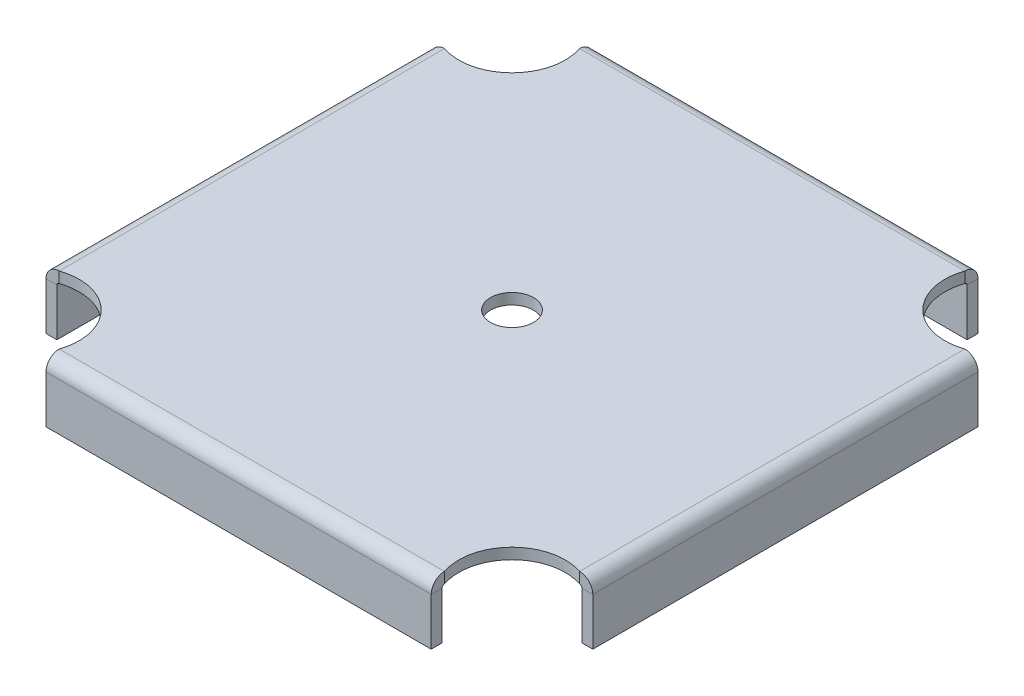
from build123d import *

# Parameters (mm, degrees)
SKETCH3_R                 = 6.7437
BASE_FLANGE1_DEPTH        = 3.4163
EDGE_FLANGE1_DEPTH        = 120.765617952
EDGE_FLANGE1_BEND_DEPTH   = 120.765617952
EDGE_FLANGE1_BEND_2_DEPTH = 120.765617952
EDGE_FLANGE1_BEND_3_DEPTH = 120.765617952


# Sheet-metal steps are written as plain solids
with BuildPart() as part:
    # Sketch3 → Base-Flange1 (new body)
    with BuildSketch(Plane(origin=(0, 0, 0), x_dir=(1, 0, 0), z_dir=(0, 1, 0))):
        with BuildLine():
            Line((-60.382808976, 81.5594), (60.382808976, 81.5594))
            ThreePointArc((60.382808976, 81.5594), (64.390963201, 64.390963201), (81.5594, 60.382808976))
            Line((81.5594, 60.382808976), (81.5594, -60.382808976))
            ThreePointArc((81.5594, -60.382808976), (64.390963201, -64.390963201), (60.382808976, -81.5594))
            Line((60.382808976, -81.5594), (-60.382808976, -81.5594))
            ThreePointArc((-60.382808976, -81.5594), (-64.390963201, -64.390963201), (-81.5594, -60.382808976))
            Line((-81.5594, -60.382808976), (-81.5594, 60.382808976))
            ThreePointArc((-81.5594, 60.382808976), (-64.390963201, 64.390963201), (-60.382808976, 81.5594))
        make_face()
        with Locations(Location((0, 0, 0), (0, 0, 270))):
            Circle(SKETCH3_R, mode=Mode.SUBTRACT)
    extrude(amount=-BASE_FLANGE1_DEPTH)

    # Edge-Flange1 section (across the edge) → Edge-Flange1 (add)
    with BuildSketch(Plane(origin=(60.382808976, -3.4163, 82.296), x_dir=(0, 0, -1), z_dir=(-1, 0, 0))):
        with BuildLine():
            Line((-3.4163, 0.7366), (-3.4163, 15.6337))
            Line((-3.4163, 15.6337), (0, 15.6337))
            Line((0, 15.6337), (0, 0.7366))
            ThreePointArc((0, 0.7366), (0.215745145, 0.215745145), (0.7366, 0))
            Line((0.7366, 0), (0.7366, -3.4163))
            ThreePointArc((0.7366, -3.4163), (-2.199943752, -2.199943752), (-3.4163, 0.7366))
        make_face()
    extrude(amount=EDGE_FLANGE1_DEPTH)

    # Edge-Flange1 section 2 (across the edge) → Edge-Flange1 bend (add)
    with BuildSketch(Plane(origin=(82.296, -3.4163, -60.382808976), x_dir=(-1, 0, 0), z_dir=(0, 0, 1))):
        with BuildLine():
            Line((-3.4163, 0.7366), (-3.4163, 15.6337))
            Line((-3.4163, 15.6337), (0, 15.6337))
            Line((0, 15.6337), (0, 0.7366))
            ThreePointArc((0, 0.7366), (0.215745145, 0.215745145), (0.7366, 0))
            Line((0.7366, 0), (0.7366, -3.4163))
            ThreePointArc((0.7366, -3.4163), (-2.199943752, -2.199943752), (-3.4163, 0.7366))
        make_face()
    extrude(amount=EDGE_FLANGE1_BEND_DEPTH)

    # Edge-Flange1 section 3 (across the edge) → Edge-Flange1 bend 2 (add)
    with BuildSketch(Plane(origin=(-60.382808976, -3.4163, -82.296), x_dir=(0, 0, 1), z_dir=(1, 0, 0))):
        with BuildLine():
            Line((-3.4163, 0.7366), (-3.4163, 15.6337))
            Line((-3.4163, 15.6337), (0, 15.6337))
            Line((0, 15.6337), (0, 0.7366))
            ThreePointArc((0, 0.7366), (0.215745145, 0.215745145), (0.7366, 0))
            Line((0.7366, 0), (0.7366, -3.4163))
            ThreePointArc((0.7366, -3.4163), (-2.199943752, -2.199943752), (-3.4163, 0.7366))
        make_face()
    extrude(amount=EDGE_FLANGE1_BEND_2_DEPTH)

    # Edge-Flange1 section 4 (across the edge) → Edge-Flange1 bend 3 (add)
    with BuildSketch(Plane(origin=(-82.296, -3.4163, 60.382808976), x_dir=(1, 0, 0), z_dir=(0, 0, -1))):
        with BuildLine():
            Line((-3.4163, 0.7366), (-3.4163, 15.6337))
            Line((-3.4163, 15.6337), (0, 15.6337))
            Line((0, 15.6337), (0, 0.7366))
            ThreePointArc((0, 0.7366), (0.215745145, 0.215745145), (0.7366, 0))
            Line((0.7366, 0), (0.7366, -3.4163))
            ThreePointArc((0.7366, -3.4163), (-2.199943752, -2.199943752), (-3.4163, 0.7366))
        make_face()
    extrude(amount=EDGE_FLANGE1_BEND_3_DEPTH)


solid = part.part
